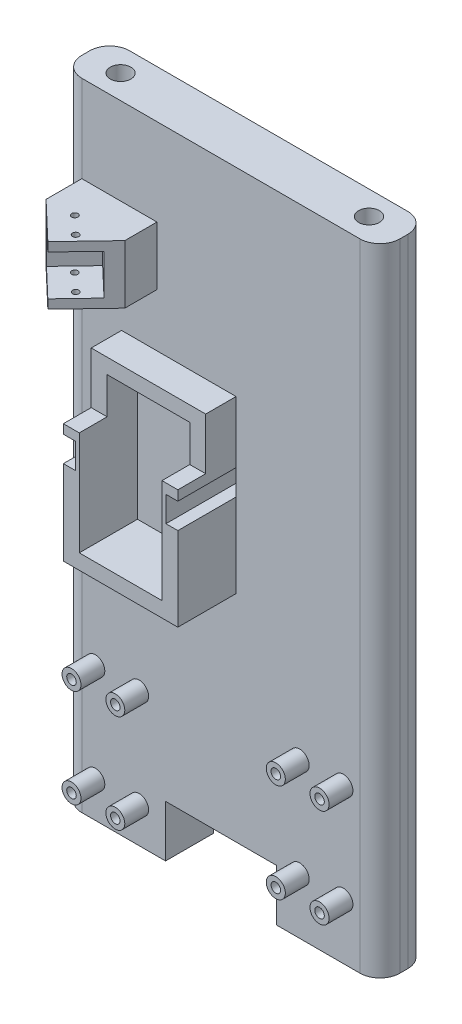
from build123d import *

# Parameters (mm, degrees)
SKETCH1_W               = 101.6
SKETCH1_H               = 203.2
BOSS_EXTRUDE1_DEPTH     = 7.62
FILLET1_R               = 6.35
FILLET2_R               = 6.35
FILLET3_R               = 6.35
FILLET4_R               = 6.35
SKETCH2_R               = 3.302
CUT_EXTRUDE1_DEPTH      = 228.312261878
SKETCH5_W               = 36.576
SKETCH5_H               = 54.5338
SKETCH5_W_2             = 26.416
SKETCH5_H_2             = 44.8818
BOSS_EXTRUDE2_DEPTH     = 18.5928
SKETCH7_W               = 24
SKETCH7_H               = 18.7
BOSS_EXTRUDE3_DEPTH     = 22.86
CUT_EXTRUDE3_DEPTH      = 229.331731479
CUT_EXTRUDE3_DEPTH_BACK = 229.331731479
SKETCH9_W               = 3.81
SKETCH9_H               = 8.128
SKETCH23_W              = 8.89
SKETCH23_H              = 16.51
CUT_EXTRUDE9_DEPTH      = 213.869730765
CUT_EXTRUDE5_DEPTH      = 20.574
CUT_EXTRUDE6_DEPTH      = 6.477
SKETCH14_R              = 3.0226
SKETCH14_R_2            = 1.524
BOSS_EXTRUDE4_DEPTH     = 7.62
SKETCH16_R              = 3.048
SKETCH16_R_2            = 1.524
BOSS_EXTRUDE5_DEPTH     = 7.62
SKETCH18_R              = 1
CUT_EXTRUDE7_DEPTH      = 18.7
SKETCH22_W              = 35.382112174
SKETCH22_H              = 16.50159333
CUT_EXTRUDE8_DEPTH      = 229.331731479


with BuildPart() as part:
    # Sketch1 → Boss-Extrude1 (new, symmetric)
    with BuildSketch(Plane.XY):
        with Locations((50.8, 101.6)):
            Rectangle(SKETCH1_W, SKETCH1_H)
    extrude(amount=BOSS_EXTRUDE1_DEPTH, both=True)

    # Fillet1
    fillet1_edges = [part.edges().sort_by_distance(p)[0] for p in [
        (101.6, 101.6, 7.62),
    ]]
    fillet(fillet1_edges, radius=FILLET1_R)

    # Fillet2
    fillet2_edges = [part.edges().sort_by_distance(p)[0] for p in [
        (101.6, 101.6, -7.62),
    ]]
    fillet(fillet2_edges, radius=FILLET2_R)

    # Fillet3
    fillet3_edges = [part.edges().sort_by_distance(p)[0] for p in [
        (0, 101.6, -7.62),
    ]]
    fillet(fillet3_edges, radius=FILLET3_R)

    # Fillet4
    fillet4_edges = [part.edges().sort_by_distance(p)[0] for p in [
        (0, 101.6, 7.62),
    ]]
    fillet(fillet4_edges, radius=FILLET4_R)

    # Sketch2 → Cut-Extrude1 (cut, through all)
    with BuildSketch(Plane(origin=(0, 203.2, 0), x_dir=(1, 0, 0), z_dir=(0, 1, 0))):
        with Locations((11.1125, 0)):
            Circle(SKETCH2_R)
        with Locations((90.4875, 0)):
            Circle(SKETCH2_R)
    extrude(amount=-CUT_EXTRUDE1_DEPTH, mode=Mode.SUBTRACT)

    # Sketch5 → Boss-Extrude2 (add)
    with BuildSketch(Plane.XY.offset(7.62)):
        with Locations((37.338, 112.5093)):
            Rectangle(SKETCH5_W, SKETCH5_H)
        with Locations((37.338, 112.5093)):
            Rectangle(SKETCH5_W_2, SKETCH5_H_2, mode=Mode.SUBTRACT)
    extrude(amount=BOSS_EXTRUDE2_DEPTH)

    # Sketch7 → Boss-Extrude3 (add)
    with BuildSketch(Plane.XY.offset(7.62)):
        with Locations((18.35, 166.068)):
            Rectangle(SKETCH7_W, SKETCH7_H)
    extrude(amount=BOSS_EXTRUDE3_DEPTH)

    # Sketch9 → Cut-Extrude3 (cut, two sides: drawn at the far end of the back side and taken through both)
    with BuildSketch(Plane.XY.offset(7.62).offset(-CUT_EXTRUDE3_DEPTH_BACK)):
        with Locations((53.721, 116.038476249)):
            Rectangle(SKETCH9_W, SKETCH9_H)
        with Locations((20.955, 116.283446292)):
            Rectangle(SKETCH9_W, SKETCH9_H)
    extrude(amount=CUT_EXTRUDE3_DEPTH + CUT_EXTRUDE3_DEPTH_BACK, mode=Mode.SUBTRACT)

    # Sketch23 → Cut-Extrude9 (cut, through all)
    with BuildSketch(Plane(origin=(55.626, 0, 0), x_dir=(0, 0, -1), z_dir=(1, 0, 0))):
        with Locations((-21.7678, 131.5212)):
            Rectangle(SKETCH23_W, SKETCH23_H)
    extrude(amount=-CUT_EXTRUDE9_DEPTH, mode=Mode.SUBTRACT)

    # Sketch12 → Cut-Extrude5 (cut)
    with BuildSketch(Plane(origin=(0, 175.418, 0), x_dir=(1, 0, 0), z_dir=(0, 1, 0))):
        Polygon((30.35, -17.881574803), (18.35, -30.48), (30.35, -30.48), align=None)
        Polygon((18.35, -30.48), (6.35, -19.05), (6.35, -30.48), align=None)
    extrude(amount=-CUT_EXTRUDE5_DEPTH, mode=Mode.SUBTRACT)

    # Sketch13 → Cut-Extrude6 (cut, symmetric)
    with BuildSketch(Plane(origin=(0, 166.068, 0), x_dir=(-1, 0, 0), z_dir=(0, -1, 0))):
        Polygon((-18.35, -30.48), (-27.109194739, -21.283995024), (-17.913189764, -12.524800285), (-9.153995024, -21.720805261), align=None)
    extrude(amount=CUT_EXTRUDE6_DEPTH, both=True, mode=Mode.SUBTRACT)

    # Sketch14 → Boss-Extrude4 (add)
    # profile 1 of 4: a face of its own
    with BuildSketch(Plane.XY.offset(7.62)):
        with Locations((10.668, 42.83)):
            Circle(SKETCH14_R)
        with Locations((10.668, 42.83)):
            Circle(SKETCH14_R_2, mode=Mode.SUBTRACT)
    # profile 2 of 4: a face of its own
    with BuildSketch(Plane.XY.offset(7.62)):
        with Locations((24.668, 42.83)):
            Circle(SKETCH14_R)
        with Locations((24.668, 42.83)):
            Circle(SKETCH14_R_2, mode=Mode.SUBTRACT)
    # profile 3 of 4: a face of its own
    with BuildSketch(Plane.XY.offset(7.62)):
        with Locations((24.668, 11.43)):
            Circle(SKETCH14_R)
        with Locations((24.668, 11.43)):
            Circle(SKETCH14_R_2, mode=Mode.SUBTRACT)
    # profile 4 of 4: a face of its own
    with BuildSketch(Plane.XY.offset(7.62)):
        with Locations((10.668, 11.43)):
            Circle(SKETCH14_R)
        with Locations((10.668, 11.43)):
            Circle(SKETCH14_R_2, mode=Mode.SUBTRACT)
    extrude(amount=BOSS_EXTRUDE4_DEPTH)

    # Sketch16 → Boss-Extrude5 (add)
    # profile 1 of 4: a face of its own
    with BuildSketch(Plane.XY.offset(7.62)):
        with Locations((75.946, 49.3522)):
            Circle(SKETCH16_R)
        with Locations((75.946, 49.3522)):
            Circle(SKETCH16_R_2, mode=Mode.SUBTRACT)
    # profile 2 of 4: a face of its own
    with BuildSketch(Plane.XY.offset(7.62)):
        with Locations((89.916, 49.3522)):
            Circle(SKETCH16_R)
        with Locations((89.916, 49.3522)):
            Circle(SKETCH16_R_2, mode=Mode.SUBTRACT)
    # profile 3 of 4: a face of its own
    with BuildSketch(Plane.XY.offset(7.62)):
        with Locations((75.946, 17.8562)):
            Circle(SKETCH16_R)
        with Locations((75.946, 17.8562)):
            Circle(SKETCH16_R_2, mode=Mode.SUBTRACT)
    # profile 4 of 4: a face of its own
    with BuildSketch(Plane.XY.offset(7.62)):
        with Locations((89.916, 17.8562)):
            Circle(SKETCH16_R)
        with Locations((89.916, 17.8562)):
            Circle(SKETCH16_R_2, mode=Mode.SUBTRACT)
    extrude(amount=BOSS_EXTRUDE5_DEPTH)

    # Sketch18 → Cut-Extrude7 (cut)
    with BuildSketch(Plane(origin=(0, 175.418, 0), x_dir=(1, 0, 0), z_dir=(0, 1, 0))):
        with Locations((20.890396375, -24.130158564)):
            Circle(SKETCH18_R)
        with Locations((15.372793389, -18.87464172)):
            Circle(SKETCH18_R)
    extrude(amount=-CUT_EXTRUDE7_DEPTH, mode=Mode.SUBTRACT)

    # Sketch22 → Cut-Extrude8 (cut, through all)
    with BuildSketch(Plane.XY.offset(7.62)):
        with Locations((50.8, 8.250796665)):
            Rectangle(SKETCH22_W, SKETCH22_H)
    extrude(amount=-CUT_EXTRUDE8_DEPTH, mode=Mode.SUBTRACT)


solid = part.part
